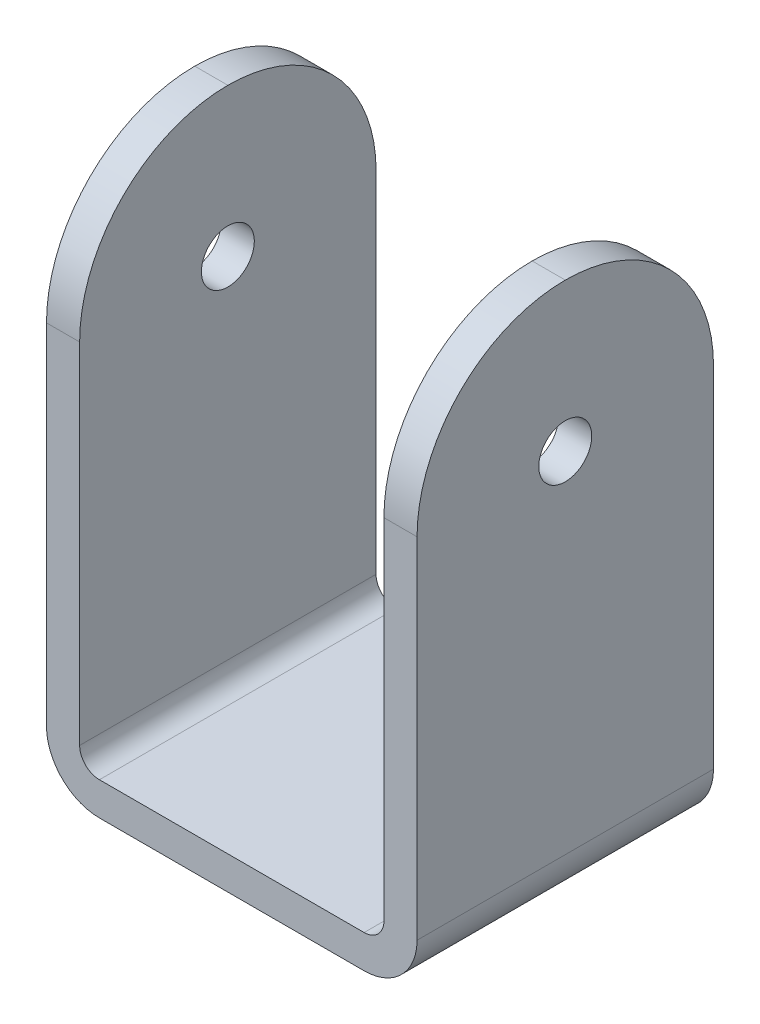
from build123d import *

# Parameters (mm, degrees)
BOSS_EXTRUDE3_DEPTH = 71.12
FILLET3_R           = 35.56
SKETCH6_R           = 6.35
CUT_EXTRUDE1_DEPTH  = 154.603584906


with BuildPart() as part:
    # Sketch1 → Boss-Extrude3 (new body)
    with BuildSketch(Plane.XY):
        with BuildLine():
            Line((-144.822728972, 103.115454206), (-144.822728972, -16.264545794))
            ThreePointArc((-144.822728972, -16.264545794), (-141.102985093, -25.244801915), (-132.122728972, -28.964545794))
            Line((-132.122728972, -28.964545794), (-68.622728972, -28.964545794))
            ThreePointArc((-68.622728972, -28.964545794), (-59.642472851, -25.244801915), (-55.922728972, -16.264545794))
            Line((-55.922728972, -16.264545794), (-55.922728972, 103.115454206))
            Line((-55.922728972, 103.115454206), (-63.872928972, 103.115454206))
            Line((-63.872928972, 103.115454206), (-63.872928972, -16.264545794))
            ThreePointArc((-63.872928972, -16.264545794), (-65.264113183, -19.623161584), (-68.622728972, -21.014345794))
            Line((-68.622728972, -21.014345794), (-132.122728972, -21.014345794))
            ThreePointArc((-132.122728972, -21.014345794), (-135.481344761, -19.623161584), (-136.872528972, -16.264545794))
            Line((-136.872528972, -16.264545794), (-136.872528972, 103.115454206))
            Line((-136.872528972, 103.115454206), (-144.822728972, 103.115454206))
        make_face()
    extrude(amount=BOSS_EXTRUDE3_DEPTH)

    # Fillet3
    fillet3_edges = [part.edges().sort_by_distance(p)[0] for p in [
        (-59.897828972, 103.115454206, 71.12),
        (-59.897828972, 103.115454206, 0),
        (-140.847628972, 103.115454206, 0),
        (-140.847628972, 103.115454206, 71.12),
    ]]
    fillet(fillet3_edges, radius=FILLET3_R - 0.0001)  # a hair under: the kernel refuses the full size

    # Sketch6 → Cut-Extrude1 (cut, through all)
    with BuildSketch(Plane(origin=(-55.922728972, 0, 0), x_dir=(0, 0, -1), z_dir=(1, 0, 0))):
        with Locations((-35.56, 67.555454206)):
            Circle(SKETCH6_R)
    extrude(amount=-CUT_EXTRUDE1_DEPTH, mode=Mode.SUBTRACT)


solid = part.part
